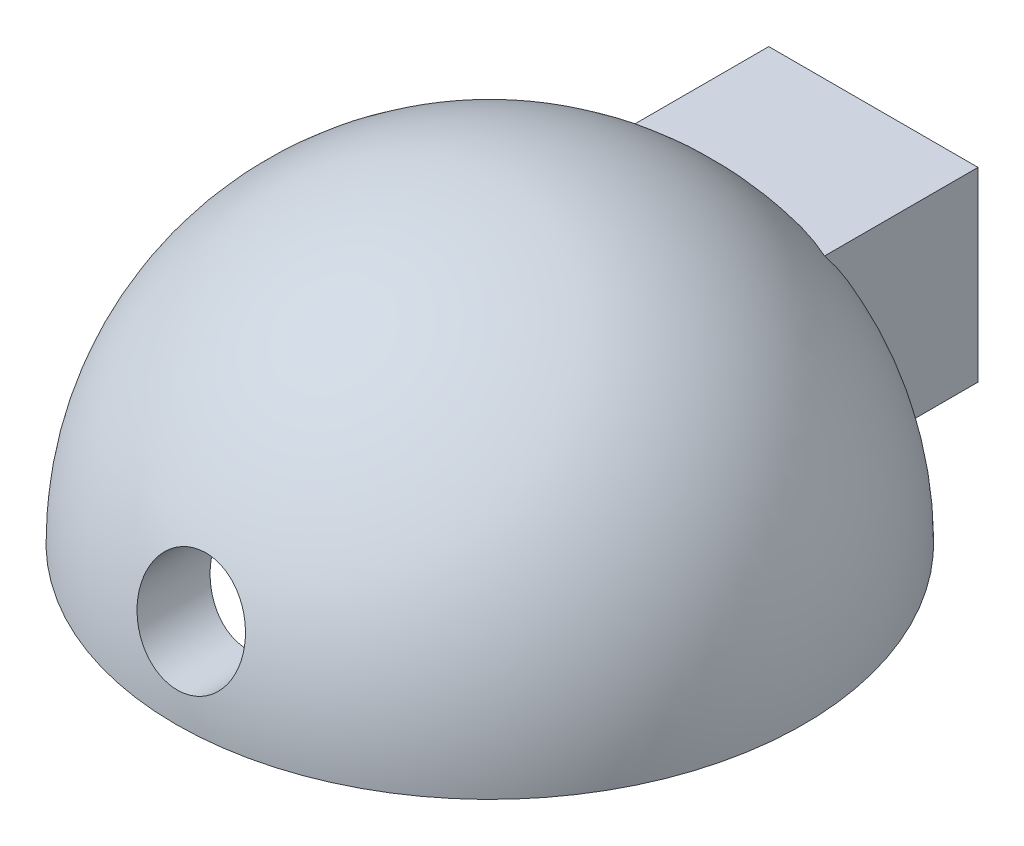
from build123d import *

# Parameters (mm, degrees)
BOSS_EXTRUDE1_REACH      = 42.773
BOSS_EXTRUDE1_END_RADIUS = 10.5
SKETCH3_W                = 9
SKETCH3_H                = 8
SKETCH3_R                = 1.25
SKETCH4_R                = 2.25
CUT_EXTRUDE1_DEPTH       = 39.618907907


with BuildPart() as part:
    # Sketch2 → Revolve1 (revolve)
    with BuildSketch(Plane.ZY.offset(3.25)):
        with BuildLine():
            Line((11.871988211, 18.951253904), (11.871988211, 21.951253904))
            ThreePointArc((11.871988211, 21.951253904), (2.326046665, 17.99719545), (-1.628011789, 8.451253904))
            Line((-1.628011789, 8.451253904), (1.371988211, 8.451253904))
            ThreePointArc((1.371988211, 8.451253904), (4.447367009, 15.875875106), (11.871988211, 18.951253904))
        make_face()
    revolve(axis=Axis((-3.25, 21.951253904, 11.871988211), (0, -1, 0)))

    # Boss-Extrude1: up to this sphere (the profile starts outside it)
    boss_extrude1_end = Location((-3.25, 8.451253904, 11.871988211)) * Sphere(BOSS_EXTRUDE1_END_RADIUS, mode=Mode.PRIVATE)
    # Sketch3 → Boss-Extrude1 (add, up to the surface)
    with BuildSketch(Plane.XY.offset(-4.628011789), mode=Mode.PRIVATE) as boss_extrude1_sk1:
        with Locations((-3.25, 12.451253904)):
            Rectangle(SKETCH3_W, SKETCH3_H)
        with Locations((-3.25, 11.951253904)):
            Circle(SKETCH3_R, mode=Mode.SUBTRACT)
    boss_extrude1_tool1 = extrude(boss_extrude1_sk1.sketch, amount=BOSS_EXTRUDE1_REACH, mode=Mode.PRIVATE) - boss_extrude1_end
    add(boss_extrude1_tool1.solids().sort_by_distance((1.129584, 12.451254, -4.628012))[0])

    # Sketch4 → Cut-Extrude1 (cut, through all)
    with BuildSketch(Plane(origin=(0, 0, -1.628011789), x_dir=(-1, 0, 0), z_dir=(0, 0, -1))):
        with Locations((3.25, 11.951253904)):
            Circle(SKETCH4_R)
    extrude(amount=-CUT_EXTRUDE1_DEPTH, mode=Mode.SUBTRACT)


solid = part.part
